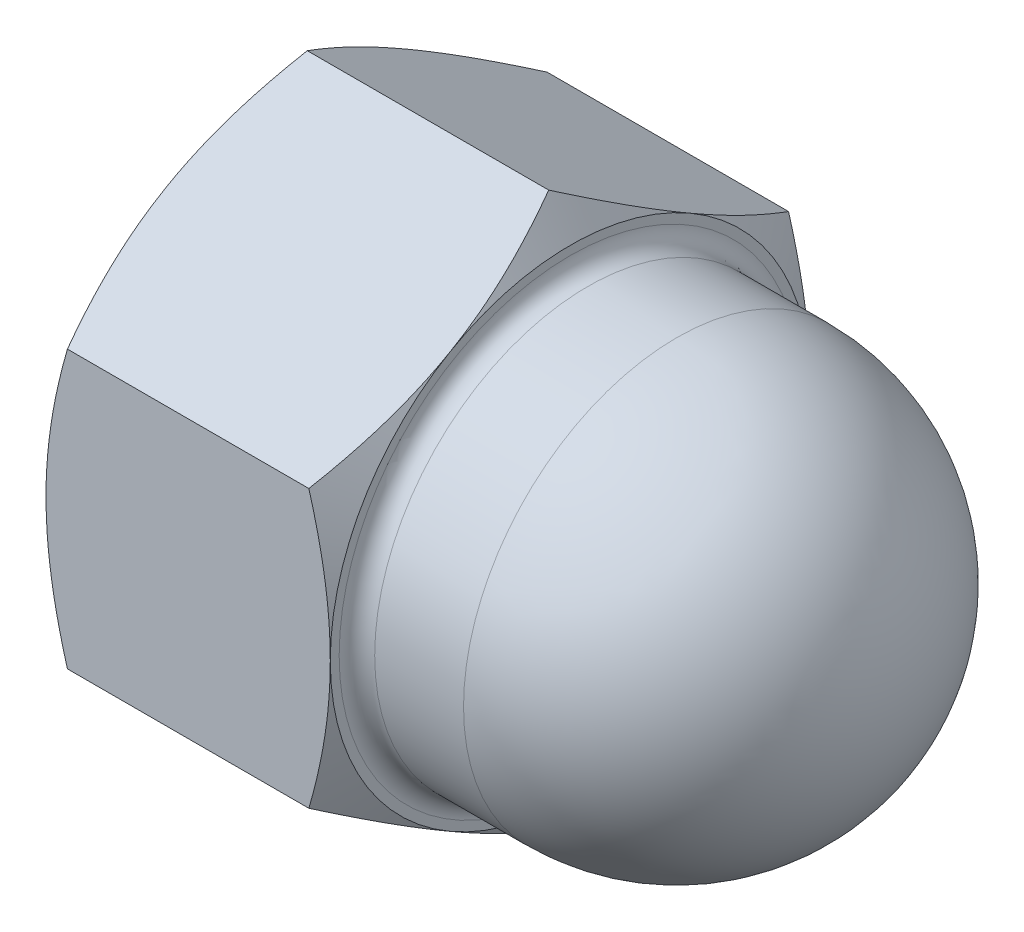
from build123d import *

# Parameters (mm, degrees)
BASENUT_DEPTH = 16
GRVSKE_W      = 7
GRVSKE_H      = 2.75
DOMEFILLET_R  = 1


with BuildPart() as part:
    # BaseNutSke → BaseNut (new body)
    with BuildSketch(Plane(origin=(0, 0, 0), x_dir=(0, 0, -1), z_dir=(1, 0, 0))):
        Polygon((13.5, 7.794228634), (13.5, -7.794228634), (0, -15.588457268), (-13.5, -7.794228634), (-13.5, 7.794228634), (0, 15.588457268), align=None)
    extrude(amount=BASENUT_DEPTH)

    # DomeSke → Dome (revolve)
    with BuildSketch(Plane.XY):
        with BuildLine():
            Line((34, 0), (0, 0))
            Line((0, 0), (0, 12))
            Line((0, 12), (22, 12))
            ThreePointArc((22, 12), (30.485281374, 8.485281374), (34, 0))
        make_face()
    revolve(axis=Axis((0, 0, 0), (1, 0, 0)))

    # Sketch4 → DoubleChamfer (revolve, cut)
    with BuildSketch(Plane.XY):
        Polygon((0, 13.5), (2.504809472, 17.838457268), (13.495190528, 17.838457268), (16, 13.5), (18, 13.5), (18, 28.5), (-2, 28.5), (-2, 13.5), align=None)
    revolve(axis=Axis((0, 0, 0), (1, 0, 0)), mode=Mode.SUBTRACT)

    # TapDriSke → TapDrill (revolve, cut)
    with BuildSketch(Plane.XY):
        Polygon((0, 8.75), (27, 8.75), (32.257530416, 0), (0, 0), align=None)
    revolve(axis=Axis((0, 0, 0), (1, 0, 0)), mode=Mode.SUBTRACT)

    # GrvSke → Groove (revolve, cut)
    with BuildSketch(Plane.XY):
        with Locations((19.5, 9.125)):
            Rectangle(GRVSKE_W, GRVSKE_H)
    revolve(axis=Axis((0, 0, 0), (1, 0, 0)), mode=Mode.SUBTRACT)

    # EndChamferSketch → EndChamfer (revolve, cut)
    with BuildSketch(Plane.XY):
        Polygon((-0.0254, 10), (0.0254, 10), (0.988185365, 8.625), (-0.0254, 8.625), align=None)
    revolve(axis=Axis((0, 0, 0), (-1, 0, 0)), mode=Mode.SUBTRACT)

    # DomeFillet
    domefillet_edges = [part.edges().sort_by_distance(p)[0] for p in [
        (16, -12, 0),
    ]]
    fillet(domefillet_edges, radius=DOMEFILLET_R)


solid = part.part
